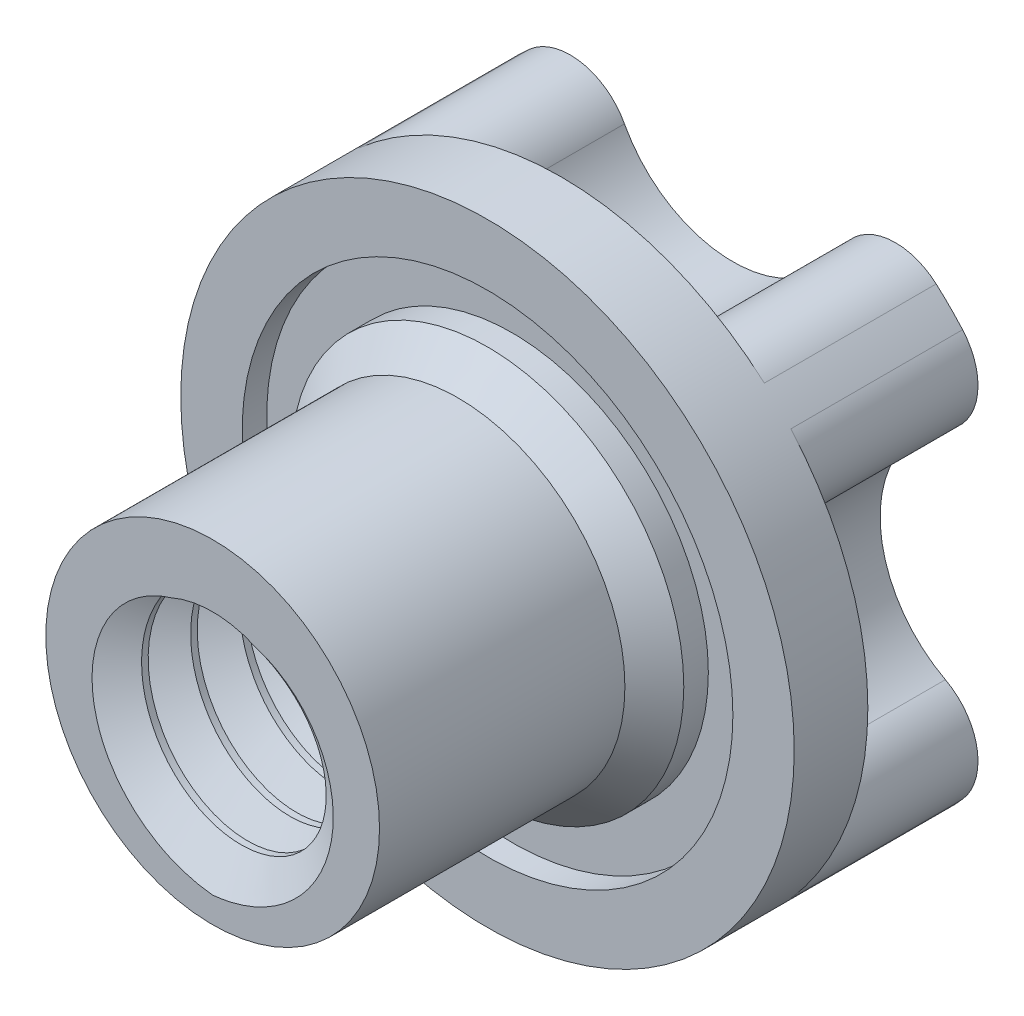
from build123d import *

# Parameters (mm, degrees)
SWEEP_13_PITCH      = 2
SKETCH_4_R          = 5
CUT_EXTRUDE_1_DEPTH = 7
FILLET_1_R          = 2.5


with BuildPart() as part:
    # Эскиз1 → Повернуть1 (revolve)
    with BuildSketch(Plane(origin=(0, 0, 0), x_dir=(1, 0, 0), z_dir=(0, 1, 0)), mode=Mode.PRIVATE) as revolve_1_sk:
        Polygon((-4.25, 0), (-6.8, 0), (-6.8, 10), (-8, 11.2), (-8, 12.2), (-10, 12.2), (-10, 11.2), (-12.5, 11.2), (-12.5, 21.2), (-4.25, 21.2), align=None)
    revolve(revolve_1_sk.sketch.rotate(Axis((0, 0, 0), (0, 0, -1)), 180), axis=Axis((0, 0, 0), (0, 0, -1)))

    # Вырез-По траектории13: the profile of Эскиз3 screwed along a right-hand helix of 15 turns, 10 arcs to a turn; built about Z, then put on its axis
    sweep_13_z = Axis((0, 0, 0), (0, 0, 1))
    sweep_13_corners = [(5.75, 0, -5), (4.104551733, 0, -5.95), (4.104551733, 0, -4.05)]
    with BuildLine(mode=Mode.PRIVATE) as sweep_13_profile:
        Line(sweep_13_corners[0], sweep_13_corners[1])
        Line(sweep_13_corners[1], sweep_13_corners[2])
        Line(sweep_13_corners[2], sweep_13_corners[0])
    sweep_13_cap = Face(sweep_13_profile.wire())
    sweep_13_turn_angles = [0, 18, 36, 54, 72, 90, 108, 126, 144, 162, 180, 198, 216, 234, 252, 270, 288, 306, 324, 342, 360]
    sweep_13_turn_weights = [1, 0.9510565162951535, 1, 0.9510565162951535, 1, 0.9510565162951535, 1, 0.9510565162951535, 1, 0.9510565162951535, 1, 0.9510565162951535, 1, 0.9510565162951535, 1, 0.9510565162951535, 1, 0.9510565162951535, 1, 0.9510565162951535, 1]
    sweep_13_turn_rails = [Edge.make_bspline([Vector(p[0], p[1], 0).rotate(sweep_13_z, sweep_13_turn_angles[k]) / sweep_13_turn_weights[k] + Vector(0, 0, p[2] + SWEEP_13_PITCH * sweep_13_turn_angles[k] / 360) for k in range(21)], [0, 0, 0, 1, 1, 2, 2, 3, 3, 4, 4, 5, 5, 6, 6, 7, 7, 8, 8, 9, 9, 10, 10, 10], 2, sweep_13_turn_weights) for p in sweep_13_corners]
    sweep_13_turn_sides = [Face.make_surface_from_curves(sweep_13_turn_rails[p[0]], sweep_13_turn_rails[p[1]]) for p in [(0, 1), (1, 2), (2, 0)]]
    sweep_13 = Plane(origin=(0, 0, 0), x_dir=(0, 1, 0), z_dir=(0, 0, -1)) * Solid(Shell([*[p.moved(Location((0, 0, SWEEP_13_PITCH * i))) for i in range(15) for p in sweep_13_turn_sides], sweep_13_cap, sweep_13_cap.rotate(sweep_13_z, 5400).moved(Location((0, 0, SWEEP_13_PITCH * 5400 / 360)))]))
    add(sweep_13, mode=Mode.SUBTRACT)

    # Эскиз4 → Вырез-Вытянуть1 (cut)
    with BuildSketch(Plane(origin=(0, 0, -21.2), x_dir=(-1, 0, 0), z_dir=(0, 0, -1))):
        with Locations((0, -11)):
            Circle(SKETCH_4_R)
        with Locations((-11, 0)):
            Circle(SKETCH_4_R)
        with Locations((0, 11)):
            Circle(SKETCH_4_R)
        with Locations((11, 0)):
            Circle(SKETCH_4_R)
    extrude(amount=-CUT_EXTRUDE_1_DEPTH, mode=Mode.SUBTRACT)

    # Скругление1
    fillet_1_edges = [part.edges().sort_by_distance(p)[0] for p in [
        (4.978245546, -11.465909091, -17.7),
        (-4.978245546, -11.465909091, -17.7),
        (11.465909091, 4.978245546, -17.7),
        (11.465909091, -4.978245546, -17.7),
        (-4.978245546, 11.465909091, -17.7),
        (4.978245546, 11.465909091, -17.7),
        (-11.465909091, -4.978245546, -17.7),
        (-11.465909091, 4.978245546, -17.7),
    ]]
    fillet(fillet_1_edges, radius=FILLET_1_R)


solid = part.part
